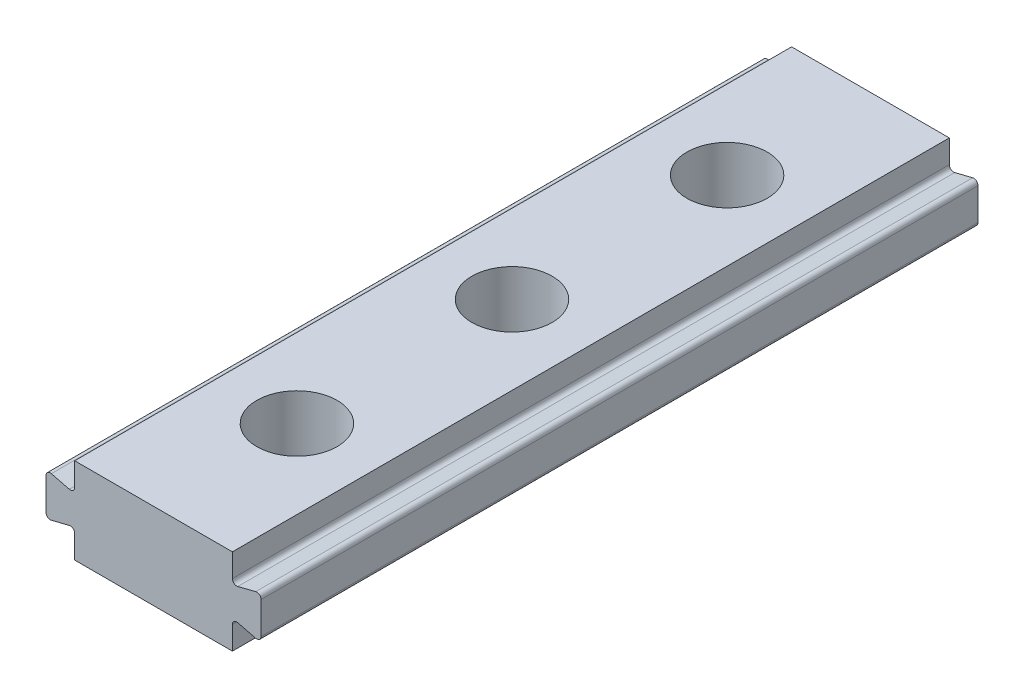
from build123d import *

# Parameters (mm, degrees)
SALIENTE_EXTRUIR1_DEPTH      = 3
SALIENTE_EXTRUIR1_DEPTH_BACK = 3
CROQUIS1_W                   = 15
CROQUIS1_H                   = 50
TALADRO1_D                   = 5.6
CORTAR_EXTRUIR2_DEPTH        = 27.272609311
REDONDEO1_R                  = 0.3
REDONDEO1_OF_SIMETR_A1_R     = 0.3
SIMETR_A2_START              = -25
SIMETR_A2_DEPTH              = 50


# Read off the part's stored shape, not the designer's step: Simetría2
with BuildPart() as part:
    # Croquis1 → Saliente-Extruir1 (new, two sides: drawn at the far end of the back side and taken through both)
    with BuildSketch(Plane(origin=(0, 0, 0), x_dir=(1, 0, 0), z_dir=(0, 1, 0)).offset(-SALIENTE_EXTRUIR1_DEPTH_BACK)):
        Rectangle(CROQUIS1_W, CROQUIS1_H)
    extrude(amount=SALIENTE_EXTRUIR1_DEPTH + SALIENTE_EXTRUIR1_DEPTH_BACK)

    # Taladro1 (through all)
    with Locations(Plane(origin=(0, 3, 0), x_dir=(1, 0, 0), z_dir=(0, 1, 0))):
        with Locations((0, 15), (0, -15), (0, 0)):
            Hole(TALADRO1_D / 2)

    # Croquis5 → Cortar-Extruir2 (cut, symmetric)
    with BuildSketch(Plane.XY):
        Polygon((5.5, -3), (5.5, -1), (7.5, -1.5), (7.5, -3), align=None)
    cortar_extruir2 = extrude(amount=CORTAR_EXTRUIR2_DEPTH, both=True, mode=Mode.SUBTRACT)

    # Redondeo1
    redondeo1_edges = [part.edges().sort_by_distance(p)[0] for p in [
        (5.5, -1, 0),
        (7.5, -1.5, 0),
    ]]
    fillet(redondeo1_edges, radius=REDONDEO1_R)

    # Simetría1: Cortar-Extruir2 across plane
    add(cortar_extruir2.mirror(Plane.ZX), mode=Mode.SUBTRACT)

    # Redondeo1 of Simetría1
    redondeo1_of_simetr_a1_edges = [part.edges().sort_by_distance(p)[0] for p in [
        (5.5, 1, 0),
        (7.5, 1.5, 0),
    ]]
    fillet(redondeo1_of_simetr_a1_edges, radius=REDONDEO1_OF_SIMETR_A1_R)

    # Simetría2 outline → Simetría2 (cut)
    with BuildSketch(Plane.XY.offset(SIMETR_A2_START)):
        with BuildLine():
            Line((-7.5, -3), (-5.5, -3))
            Line((-5.5, -3), (-5.5, -1.384232922))
            ThreePointArc((-5.5, -1.384232922), (-5.615376338, -1.147771291), (-5.872760688, -1.093190172))
            Line((-5.872760688, -1.093190172), (-7.127239312, -1.406809828))
            ThreePointArc((-7.127239312, -1.406809828), (-7.384623662, -1.352228709), (-7.5, -1.115767078))
            Line((-7.5, -1.115767078), (-7.5, -3))
        make_face()
        with BuildLine():
            Line((-7.5, 3), (-7.5, 1.115767078))
            ThreePointArc((-7.5, 1.115767078), (-7.384623662, 1.352228709), (-7.127239312, 1.406809828))
            Line((-7.127239312, 1.406809828), (-5.872760688, 1.093190172))
            ThreePointArc((-5.872760688, 1.093190172), (-5.615376338, 1.147771291), (-5.5, 1.384232922))
            Line((-5.5, 1.384232922), (-5.5, 3))
            Line((-5.5, 3), (-7.5, 3))
        make_face()
    extrude(amount=SIMETR_A2_DEPTH, mode=Mode.SUBTRACT)


solid = part.part
